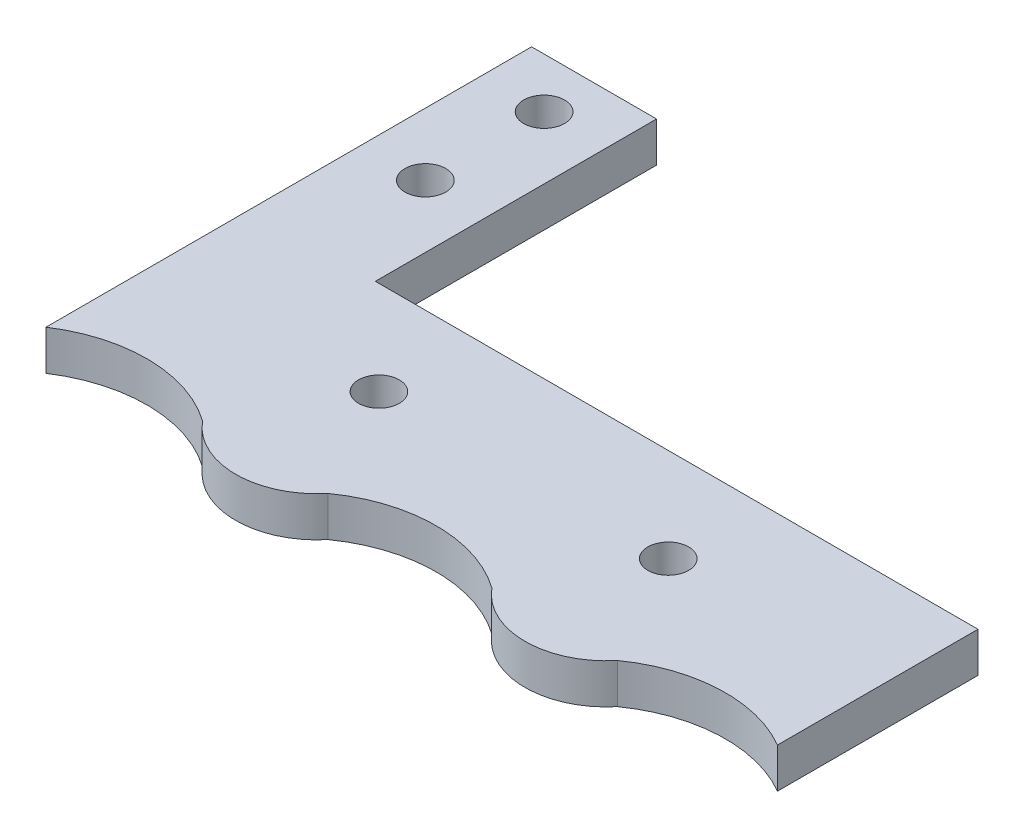
from build123d import *

# Parameters (mm, degrees)
BASE_FLANGE1_DEPTH        = 3.2
SKETCH8_R                 = 1.635
CUT_EXTRUDE1_DEPTH        = 3.2
F_4_CLEARANCE_HOLE2_D     = 3.2639
F_4_CLEARANCE_HOLE2_DEPTH = 3.2
F_4_CLEARANCE_HOLE2_TIP   = 0.980574487
CUT_EXTRUDE2_DEPTH        = 3.2


# Sheet-metal steps are written as plain solids
with BuildPart() as part:
    # Sketch3 → Base-Flange1 (new body)
    with BuildSketch(Plane(origin=(0, 0, 0), x_dir=(1, 0, 0), z_dir=(0, 1, 0))):
        with BuildLine():
            Line((-29.358964924, 8.867320879), (-29.358964924, 25.825))
            Line((-29.358964924, 25.825), (-29.358964924, 48.325))
            Line((-29.358964924, 48.325), (-19.358964924, 48.325))
            Line((-19.358964924, 48.325), (-19.358964924, 25.825))
            Line((-19.358964924, 25.825), (29.358964924, 25.825))
            Line((29.358964924, 25.825), (29.358964924, 8.867320879))
            ThreePointArc((29.358964924, 8.867320879), (23.15, 10.825), (16.941035076, 8.867320879))
            ThreePointArc((16.941035076, 8.867320879), (11.575, 6.362392354), (6.208964924, 8.867320879))
            ThreePointArc((6.208964924, 8.867320879), (0, 10.825), (-6.208964924, 8.867320879))
            ThreePointArc((-6.208964924, 8.867320879), (-11.575, 6.362392354), (-16.941035076, 8.867320879))
            ThreePointArc((-16.941035076, 8.867320879), (-23.15, 10.825), (-29.358964924, 8.867320879))
        make_face()
    extrude(amount=-BASE_FLANGE1_DEPTH)

    # Sketch8 → Cut-Extrude1 (cut)
    with BuildSketch(Plane(origin=(0, 0, 0), x_dir=(1, 0, 0), z_dir=(0, 1, 0))):
        with Locations(Location((-24.358964924, 44.325, 0), (0, 0, 270))):
            Circle(SKETCH8_R)
        with Locations(Location((-24.358964924, 34.825, 0), (0, 0, 270))):
            Circle(SKETCH8_R)
    extrude(amount=-CUT_EXTRUDE1_DEPTH, mode=Mode.SUBTRACT)

    # #4 Clearance Hole2
    with Locations(Plane.XZ.offset(3.2)):
        with Locations((11.575, -18.325), (-11.575, -18.325)):
            Hole(F_4_CLEARANCE_HOLE2_D / 2, depth=F_4_CLEARANCE_HOLE2_DEPTH)
            with Locations((0, 0, -(F_4_CLEARANCE_HOLE2_DEPTH + F_4_CLEARANCE_HOLE2_TIP / 2))):  # 118° drill point
                Cone(0, F_4_CLEARANCE_HOLE2_D / 2, F_4_CLEARANCE_HOLE2_TIP, mode=Mode.SUBTRACT)

    # Sketch11 → Cut-Extrude2 (cut)
    with BuildSketch(Plane.XZ.offset(3.2)):
        with BuildLine():
            Line((-29.645753142, -9.276896902), (-29.645753142, -3.891418545))
            Line((-29.645753142, -3.891418545), (33.433786827, -3.891418545))
            Line((33.433786827, -3.891418545), (33.433786827, -25.825))
            Line((33.433786827, -25.825), (28.858964924, -25.825))
            Line((28.858964924, -25.825), (28.858964924, -9.780764004))
            ThreePointArc((28.858964924, -9.780764004), (22.648874034, -11.313907272), (16.598650974, -9.237718925))
            ThreePointArc((16.598650974, -9.237718925), (11.575, -6.862392354), (6.551349026, -9.237718925))
            ThreePointArc((6.551349026, -9.237718925), (0, -11.325), (-6.551349026, -9.237718925))
            ThreePointArc((-6.551349026, -9.237718925), (-11.575, -6.862392354), (-16.598650974, -9.237718925))
            ThreePointArc((-16.598650974, -9.237718925), (-23.115993323, -11.324948942), (-29.645753142, -9.276896902))
        make_face()
    extrude(amount=-CUT_EXTRUDE2_DEPTH, mode=Mode.SUBTRACT)


solid = part.part
